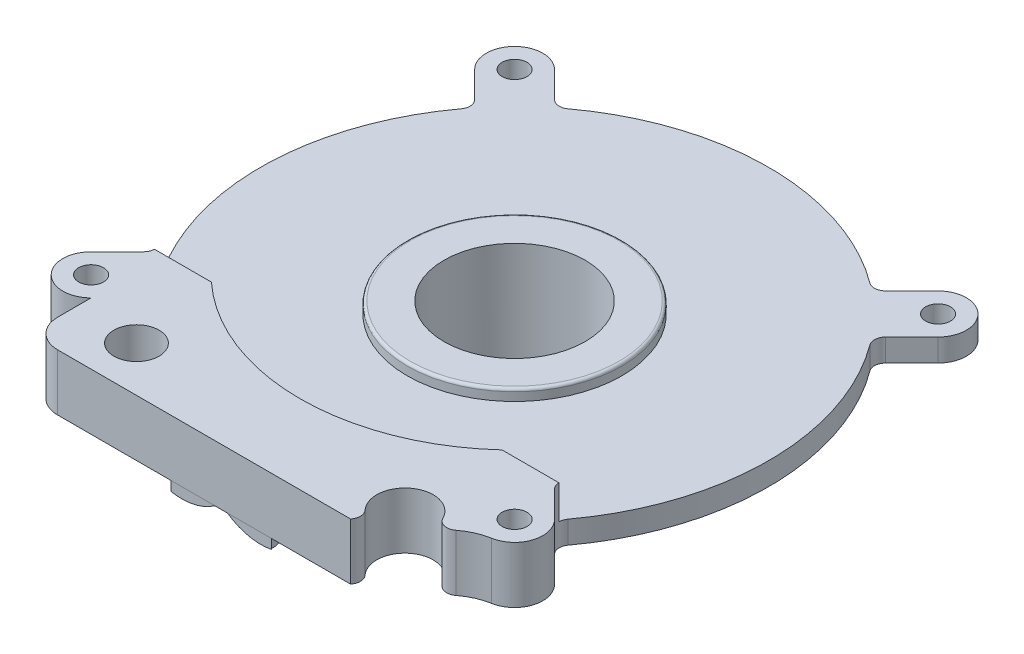
from build123d import *
from build123d.topology import SkipClean

# Parameters (mm, degrees)
SKETCH_1_R               = 15
SKETCH_1_R_2             = 12.5
EXTRUDE_1_DEPTH          = 20
SKETCH_2_R               = 17
SKETCH_2_R_2             = 12.5
EXTRUDE_2_DEPTH          = 6
SKETCH_3_R               = 12.5
SKETCH_3_R_2             = 7
SKETCH_3_R_3             = 1.65
EXTRUDE_3_DEPTH          = 3
EXTRUDE_START            = -2
SKETCH_5_R               = 19
SKETCH_5_R_2             = 17
EXTRUDE_5_DEPTH          = 2
SKETCH_6_W               = 26
SKETCH_6_H               = 26
SKETCH_6_R               = 12.5
EXTRUDE_6_DEPTH          = 2
EXTRUDE_START_2          = 4
SKETCH_7_R               = 45
SKETCH_7_R_2             = 17
EXTRUDE_7_DEPTH          = 4
EXTRUDE_START_3          = -4
SKETCH_8_R               = 2.2
EXTRUDE_8_DEPTH          = 4
SKETCH_9_R               = 4
EXTRUDE_9_DEPTH          = 4
FILLET_1_R               = 2
SKETCH_10_R              = 19
CUT_EXTRUDE_1_DEPTH      = 74.492092218
FILLET_2_R               = 0.5
FILLET_3_R               = 5
SKETCH_11_R              = 3
CUT_EXTRUDE_2_DEPTH      = 1.5
EXTRUDE_START_4          = 1
SKETCH_12_R              = 15.75
SKETCH_12_R_2            = 15
EXTRUDE_10_DEPTH         = 1
SKETCH_13_R              = 4
SKETCH_13_R_2            = 2.2
EXTRUDE_11_DEPTH         = 4.2
EXTRUDE_12_DEPTH         = 7
EXTRUDE_12_2_DEPTH       = 7
CHAMFER_1_SIZE           = 6.214619975
CHAMFER_1_SIZE_2         = 1.9
CHAMFER_2_SIZE           = 6.214619975
CHAMFER_2_SIZE_2         = 1.9
CUT_EXTRUDE_4_DEPTH      = 10
FILLET_4_R               = 2
SKETCH_16_R              = 2.2
SKETCH_16_R_2            = 4
EXTRUDE_13_DEPTH         = 3
CUT_EXTRUDE_START        = -0.2
CUT_EXTRUDE_5_DEPTH      = 0.2
CUT_EXTRUDE_6_DEPTH      = 112.30004797
CUT_EXTRUDE_6_DEPTH_BACK = 112.30004797
SKETCH_18_W              = 118.870739278
SKETCH_18_H              = 2


with BuildPart() as part:
    # 草图1 → 凸台-拉伸1 (new body)
    with BuildSketch(Plane(origin=(0, 0, 0), x_dir=(1, 0, 0), z_dir=(0, 1, 0))):
        with Locations(Location((0, 0, 0), (0, 0, 270))):
            Circle(SKETCH_1_R)
        with Locations(Location((0, 0, 0), (0, 0, 270))):
            Circle(SKETCH_1_R_2, mode=Mode.SUBTRACT)
    extrude(amount=EXTRUDE_1_DEPTH)

    # 草图2 → 凸台-拉伸2 (add)
    with BuildSketch(Plane(origin=(0, 20, 0), x_dir=(1, 0, 0), z_dir=(0, 1, 0))):
        with Locations(Location((0, 0, 0), (0, 0, 270))):
            Circle(SKETCH_2_R)
        with Locations(Location((0, 0, 0), (0, 0, 270))):
            Circle(SKETCH_2_R_2, mode=Mode.SUBTRACT)
    extrude(amount=EXTRUDE_2_DEPTH)

    # 草图3 → 凸台-拉伸3 (add)
    with BuildSketch(Plane.XZ):
        with Locations(Location((0, 0, 0), (0, 0, 270))):
            Circle(SKETCH_3_R)
        with Locations(Location((0, 0, 0), (0, 0, 270))):
            Circle(SKETCH_3_R_2, mode=Mode.SUBTRACT)
        with Locations(Location((9.5, 0, 0), (0, 0, 270))):
            Circle(SKETCH_3_R_3, mode=Mode.SUBTRACT)
        with Locations(Location((-4.75, -8.227241336, 0), (0, 0, 270))):
            Circle(SKETCH_3_R_3, mode=Mode.SUBTRACT)
        with Locations(Location((-4.75, 8.227241336, 0), (0, 0, 270))):
            Circle(SKETCH_3_R_3, mode=Mode.SUBTRACT)
    extrude(amount=-EXTRUDE_3_DEPTH)

    # 草图5 → 凸台-拉伸5 (add)
    with BuildSketch(Plane(origin=(0, 26, 0), x_dir=(1, 0, 0), z_dir=(0, 1, 0)).offset(EXTRUDE_START)):
        with Locations(Location((0, 0, 0), (0, 0, 270))):
            Circle(SKETCH_5_R)
        with Locations(Location((0, 0, 0), (0, 0, 270))):
            Circle(SKETCH_5_R_2, mode=Mode.SUBTRACT)
    extrude(amount=EXTRUDE_5_DEPTH)

    # 草图6 → 凸台-拉伸6 (add)
    with BuildSketch(Plane(origin=(0, 26, 0), x_dir=(1, 0, 0), z_dir=(0, 1, 0))):
        Rectangle(SKETCH_6_W, SKETCH_6_H)
        with Locations(Location((0, 0, 0), (0, 0, 90))):
            Circle(SKETCH_6_R, mode=Mode.SUBTRACT)
    extrude(amount=EXTRUDE_6_DEPTH)

    # 草图7 → 凸台-拉伸7 (add)
    with BuildSketch(Plane.XZ.offset(-24).offset(EXTRUDE_START_2)):
        with Locations(Location((0, 0, 0), (0, 0, 270))):
            Circle(SKETCH_7_R)
        Circle(SKETCH_7_R_2, mode=Mode.SUBTRACT)
    extrude(amount=-EXTRUDE_7_DEPTH)

    # 草图8 → 凸台-拉伸8 (add)
    # profile 1 of 4: a face of its own
    with BuildSketch(Plane(origin=(0, 24, 0), x_dir=(1, 0, 0), z_dir=(0, 1, 0)).offset(EXTRUDE_START_3)):
        with BuildLine():
            Line((-41.035533906, -33.964466094), (-35.158310508, -28.087242696))
            ThreePointArc((-35.158310508, -28.087242696), (-31.819805153, -31.819805153), (-28.087242696, -35.158310508))
            Line((-28.087242696, -35.158310508), (-33.964466094, -41.035533906))
            ThreePointArc((-33.964466094, -41.035533906), (-41.035533906, -41.035533906), (-41.035533906, -33.964466094))
        make_face()
        with Locations(Location((-37.5, -37.5, 0), (0, 0, 270))):
            Circle(SKETCH_8_R, mode=Mode.SUBTRACT)
    # profile 2 of 4: a face of its own
    with BuildSketch(Plane(origin=(0, 24, 0), x_dir=(1, 0, 0), z_dir=(0, 1, 0)).offset(EXTRUDE_START_3)):
        with BuildLine():
            Line((-41.035533906, 33.964466094), (-35.158310508, 28.087242696))
            ThreePointArc((-35.158310508, 28.087242696), (-31.819805153, 31.819805153), (-28.087242696, 35.158310508))
            Line((-28.087242696, 35.158310508), (-33.964466094, 41.035533906))
            ThreePointArc((-33.964466094, 41.035533906), (-41.035533906, 41.035533906), (-41.035533906, 33.964466094))
        make_face()
        with Locations(Location((-37.5, 37.5, 0), (0, 0, 270))):
            Circle(SKETCH_8_R, mode=Mode.SUBTRACT)
    # profile 3 of 4: a face of its own
    with BuildSketch(Plane(origin=(0, 24, 0), x_dir=(1, 0, 0), z_dir=(0, 1, 0)).offset(EXTRUDE_START_3)):
        with BuildLine():
            Line((28.087242696, 35.158310508), (33.964466094, 41.035533906))
            ThreePointArc((33.964466094, 41.035533906), (41.035533906, 41.035533906), (41.035533906, 33.964466094))
            Line((41.035533906, 33.964466094), (35.158310508, 28.087242696))
            ThreePointArc((35.158310508, 28.087242696), (31.819805153, 31.819805153), (28.087242696, 35.158310508))
        make_face()
        with Locations(Location((37.5, 37.5, 0), (0, 0, 270))):
            Circle(SKETCH_8_R, mode=Mode.SUBTRACT)
    # profile 4 of 4: a face of its own
    with BuildSketch(Plane(origin=(0, 24, 0), x_dir=(1, 0, 0), z_dir=(0, 1, 0)).offset(EXTRUDE_START_3)):
        with BuildLine():
            Line((35.158310508, -28.087242696), (41.035533906, -33.964466094))
            ThreePointArc((41.035533906, -33.964466094), (41.035533906, -41.035533906), (33.964466094, -41.035533906))
            Line((33.964466094, -41.035533906), (28.087242696, -35.158310508))
            ThreePointArc((28.087242696, -35.158310508), (31.819805153, -31.819805153), (35.158310508, -28.087242696))
        make_face()
        with Locations(Location((37.5, -37.5, 0), (0, 0, 270))):
            Circle(SKETCH_8_R, mode=Mode.SUBTRACT)
    extrude(amount=EXTRUDE_8_DEPTH)

    # 草图9 → 凸台-拉伸9 (add)
    with BuildSketch(Plane(origin=(0, 24, 0), x_dir=(1, 0, 0), z_dir=(0, 1, 0)).offset(EXTRUDE_START_3)):
        with BuildLine():
            Line((33.964466094, -41.035533906), (28.087242696, -35.158310508))
            ThreePointArc((28.087242696, -35.158310508), (0, -45), (-28.087242696, -35.158310508))
            Line((-28.087242696, -35.158310508), (-33.964466094, -41.035533906))
            Line((-33.964466094, -41.035533906), (-33.964466094, -51.96236733))
            Line((-33.964466094, -51.96236733), (22.906384924, -51.96236733))
            Line((22.906384924, -51.96236733), (27.649740331, -50.798447588))
            ThreePointArc((27.649740331, -50.798447588), (23.364635585, -42.046040599), (31.045885235, -48.043136112))
            ThreePointArc((31.045885235, -48.043136112), (34.020425636, -44.337927578), (38.36930714, -42.423850637))
            ThreePointArc((38.36930714, -42.423850637), (35.996987316, -42.268747516), (33.964466094, -41.035533906))
        make_face()
        with Locations(Location((-23.001616716, -43.96067534, 0), (0, 0, 270))):
            Circle(SKETCH_9_R, mode=Mode.SUBTRACT)
    extrude(amount=EXTRUDE_9_DEPTH)

    # 圆角1
    # the kernel refuses this fillet: 2 mm, written as the material it takes off along each edge
    with BuildSketch(Plane(origin=(31.045885235, 8.214854918, 48.043136112), x_dir=(-0.015052067443698006, 0, -0.9998867112156609), z_dir=(0, 1, 0))) as fillet_1_piece_1:
        with BuildLine():
            CenterArc((5.237242596, -1.799472632), FILLET_1_R, 115.876571243, 100.980737452)
            Line((3.636978972, -2.999121053), (3.6049737, -3.023114021))
            ThreePointArc((3.6049737, -3.023114021), (1.972291731, -1.313047371), (-0.017457357, -0.035989453))
            Line((-0.017457357, -0.035989453), (0.017457357, 0.035989453))
            ThreePointArc((0.017457357, 0.035989453), (2.182187383, -0.461322512), (4.34691741, 0.035989453))
            Line((4.34691741, 0.035989453), (4.364374767, 0))
        make_face()
    extrude(amount=27.570290164, mode=Mode.SUBTRACT)
    with BuildSketch(Plane(origin=(27.649740331, 7.426134815, 50.798447588), x_dir=(-0.9711892764491741, 0, 0.23830944024551268), z_dir=(0, 1, 0))) as fillet_1_piece_2:
        with BuildLine():
            CenterArc((6.067575487, -1.612238295), FILLET_1_R, 126.281523765, 82.66024712)
            Line((4.317351562, -2.580079301), (4.282347084, -2.599436121))
            ThreePointArc((4.282347084, -2.599436121), (2.486180213, -0.742013172), (-0.000465948, -0.039997286))
            Line((-0.000465948, -0.039997286), (0, 0.04))
            ThreePointArc((0, 0.04), (2.442034484, 0.04), (4.860398838, 0.032244766))
            Line((4.860398838, 0.032244766), (4.884068968, 0))
        make_face()
    extrude(amount=29.147730371, mode=Mode.SUBTRACT)

    # 草图10 → 切除-拉伸1 (cut, through all)
    with BuildSketch(Plane(origin=(0, 26, 0), x_dir=(1, 0, 0), z_dir=(0, 1, 0))):
        with Locations(Location((0, 0, 0), (0, 0, 270))):
            Circle(SKETCH_10_R)
    extrude(amount=CUT_EXTRUDE_1_DEPTH, mode=Mode.SUBTRACT)

    # 圆角2
    fillet_2_edges = [part.edges().sort_by_distance(p)[0] for p in [
        (0, 26, -19),
    ]]
    fillet(fillet_2_edges, radius=FILLET_2_R)

    # 圆角3
    fillet_3_edges = [part.edges().sort_by_distance(p)[0] for p in [
        (-33.964466094, 22, 51.96236733),
    ]]
    fillet(fillet_3_edges, radius=FILLET_3_R)

    # 草图11 → 切除-拉伸2 (cut)
    with BuildSketch(Plane.XZ):
        with Locations((-4.75, 8.227241336)):
            Circle(SKETCH_11_R)
        with Locations((9.5, 0)):
            Circle(SKETCH_11_R)
        with Locations((-4.75, -8.227241336)):
            Circle(SKETCH_11_R)
    extrude(amount=-CUT_EXTRUDE_2_DEPTH, mode=Mode.SUBTRACT)

    # 草图12 → 凸台-拉伸10 (add)
    with BuildSketch(Plane.XZ.offset(-20).offset(EXTRUDE_START_4)):
        with Locations(Location((0, 0, 0), (0, 0, 90))):
            Circle(SKETCH_12_R)
        with Locations(Location((0, 0, 0), (0, 0, 270))):
            Circle(SKETCH_12_R_2, mode=Mode.SUBTRACT)
    extrude(amount=-EXTRUDE_10_DEPTH)

    # 草图13 → 凸台-拉伸11 (add)
    # profile 1 of 2: a face of its own
    with BuildSketch(Plane(origin=(0, 24, 0), x_dir=(1, 0, 0), z_dir=(0, 1, 0))):
        with BuildLine():
            Line((-25.73142074, -27.96236733), (-35.257708566, -27.96236733))
            ThreePointArc((-35.257708566, -27.96236733), (-35.2080649, -28.024849081), (-35.158310508, -28.087242696))
            ThreePointArc((-35.158310508, -28.087242696), (0, -45), (35.158310508, -28.087242696))
            ThreePointArc((35.158310508, -28.087242696), (35.2080649, -28.024849081), (35.257708566, -27.96236733))
            Line((35.257708566, -27.96236733), (25.73142074, -27.96236733))
            ThreePointArc((25.73142074, -27.96236733), (0, -38), (-25.73142074, -27.96236733))
        make_face()
    # profile 2 of 2: a face of its own
    with BuildSketch(Plane(origin=(0, 24, 0), x_dir=(1, 0, 0), z_dir=(0, 1, 0))):
        with BuildLine():
            ThreePointArc((35.158310508, -28.087242696), (0, -45), (-35.158310508, -28.087242696))
            Line((-35.158310508, -28.087242696), (-41.035533906, -33.964466094))
            ThreePointArc((-41.035533906, -33.964466094), (-41.035533906, -41.035533906), (-33.964466094, -41.035533906))
            Line((-33.964466094, -41.035533906), (-33.964466094, -46.96236733))
            ThreePointArc((-33.964466094, -46.96236733), (-32.5, -50.497901236), (-28.964466094, -51.96236733))
            Line((-28.964466094, -51.96236733), (22.906384924, -51.96236733))
            ThreePointArc((22.906384924, -51.96236733), (23.372168796, -50.629809961), (22.841917537, -49.321567873))
            ThreePointArc((22.841917537, -49.321567873), (23.665985567, -41.819836541), (30.980192372, -43.67925578))
            ThreePointArc((30.980192372, -43.67925578), (32.324226236, -44.729926812), (33.989922469, -44.361426197))
            ThreePointArc((33.989922469, -44.361426197), (36.06191813, -43.126615751), (38.36930714, -42.423850637))
            ThreePointArc((38.36930714, -42.423850637), (42.268747516, -39.003012684), (41.035533906, -33.964466094))
            Line((41.035533906, -33.964466094), (35.158310508, -28.087242696))
        make_face()
        with Locations(Location((-23.001616716, -43.96067534, 0), (0, 0, 270))):
            Circle(SKETCH_13_R, mode=Mode.SUBTRACT)
        with Locations(Location((-37.5, -37.5, 0), (0, 0, 270))):
            Circle(SKETCH_13_R_2, mode=Mode.SUBTRACT)
        with Locations(Location((37.5, -37.5, 0), (0, 0, 270))):
            Circle(SKETCH_13_R_2, mode=Mode.SUBTRACT)
    extrude(amount=EXTRUDE_11_DEPTH)

    # 圆角4
    # the kernel refuses this fillet: 2 mm, written as the material it adds along each edge
    with BuildSketch(Plane(origin=(-35.158310508, 24, 28.087242696), x_dir=(-0.6091445543009105, 0, -0.793059210882482), z_dir=(0, 1, 0))) as fillet_4_piece_1_section:
        with BuildLine():
            CenterArc((1.754855317, 1.99963613), FILLET_4_R, 187.472325658, 81.434718893)
            Line((-0.228160265, 1.739541528), (0, 0))
            ThreePointArc((0, 0), (0.858353144, 0.008187079), (1.716706288, 0))
        make_face()
    fillet_4_piece_1 = extrude(amount=4.2, mode=Mode.PRIVATE)
    fillet_4_piece_1 = split(fillet_4_piece_1, bisect_by=Plane(origin=(-35.158310508, 24, 27.96236733), z_dir=(0, 0, 1)), keep=Keep.TOP, mode=Mode.PRIVATE)
    add(fillet_4_piece_1)
    with BuildSketch(Plane(origin=(28.087242696, 20, -35.158310508), x_dir=(0.7071067811865485, 0, -0.7071067811865465), z_dir=(0, 1, 0)), Plane(origin=(-35.158310508, 20, -28.087242696), x_dir=(-0.7071067811865496, 0, -0.7071067811865455), z_dir=(0, 1, 0))) as fillet_4_piece_2:
        with BuildLine():
            CenterArc((1.754440604, 2), FILLET_4_R, 188.565281108, 81.434718892)
            ThreePointArc((-0.223253019, 1.70212766), (-0.103508957, 0.852128537), (0, 0))
            Line((0, 0), (1.754440604, 0))
        make_face()
    extrude(amount=4)
    with BuildSketch(Plane(origin=(35.158310508, 20, -28.087242696), x_dir=(0.6091445542993271, 0, 0.7930592108836982), z_dir=(0, 1, 0)), Plane(origin=(-28.087242696, 20, -35.158310508), x_dir=(0.7930592108837022, 0, -0.6091445542993219), z_dir=(0, 1, 0)), Plane(origin=(-35.158310508, 20, 28.087242696), x_dir=(-0.6091445542993226, 0, -0.7930592108837018), z_dir=(0, 1, 0))) as fillet_4_piece_3:
        with BuildLine():
            CenterArc((1.754855317, 1.99963613), FILLET_4_R, 187.472325658, 81.434718892)
            Line((-0.228160265, 1.739541528), (0, 0))
            ThreePointArc((0, 0), (0.858353144, 0.008187079), (1.716706288, 0))
        make_face()
    extrude(amount=4)
    with BuildSketch(Plane(origin=(35.158310508, 24, 28.087242696), x_dir=(0.6091445574940213, 0, -0.7930592084298707), z_dir=(0, 1, 0))) as fillet_4_piece_4_section:
        with BuildLine():
            CenterArc((1.754855324, -1.99963613), FILLET_4_R, 91.092955673, 81.4347189)
            Line((-0.228160259, -1.739541536), (0, 0))
            ThreePointArc((0, 0), (0.858353144, -0.008187083), (1.716706288, 0))
        make_face()
    fillet_4_piece_4 = extrude(amount=4.2, mode=Mode.PRIVATE)
    fillet_4_piece_4 = split(fillet_4_piece_4, bisect_by=Plane(origin=(35.158310508, 24, 27.96236733), z_dir=(0, 0, 1)), keep=Keep.TOP, mode=Mode.PRIVATE)
    add(fillet_4_piece_4)
    with BuildSketch(Plane(origin=(35.158310508, 20, 28.087242696), x_dir=(0.609144554299323, 0, -0.7930592108837013), z_dir=(0, 1, 0))) as fillet_4_piece_5:
        with BuildLine():
            CenterArc((1.754855317, -1.99963613), FILLET_4_R, 91.09295545, 81.434718892)
            Line((-0.228160265, -1.739541528), (0, 0))
            ThreePointArc((0, 0), (0.858353144, -0.008187079), (1.716706288, 0))
        make_face()
    extrude(amount=4)

    # 草图16 → 凸台-拉伸13 (add)
    with BuildSketch(Plane(origin=(0, 28.2, 0), x_dir=(1, 0, 0), z_dir=(0, 1, 0))):
        with BuildLine():
            Line((-25.73142074, -27.96236733), (-35.813695424, -27.96236733))
            ThreePointArc((-35.813695424, -27.96236733), (-35.974809945, -28.701442447), (-36.398887356, -29.327819544))
            Line((-36.398887356, -29.327819544), (-41.035533906, -33.964466094))
            ThreePointArc((-41.035533906, -33.964466094), (-41.035533906, -41.035533906), (-33.964466094, -41.035533906))
            Line((-33.964466094, -41.035533906), (-33.964466094, -46.96236733))
            ThreePointArc((-33.964466094, -46.96236733), (-32.5, -50.497901236), (-28.964466094, -51.96236733))
            Line((-28.964466094, -51.96236733), (22.906384924, -51.96236733))
            ThreePointArc((22.906384924, -51.96236733), (23.372168796, -50.629809961), (22.841917537, -49.321567873))
            ThreePointArc((22.841917537, -49.321567873), (23.665985567, -41.819836541), (30.980192372, -43.67925578))
            ThreePointArc((30.980192372, -43.67925578), (32.324226236, -44.729926812), (33.989922469, -44.361426197))
            ThreePointArc((33.989922469, -44.361426197), (36.06191813, -43.126615751), (38.36930714, -42.423850637))
            ThreePointArc((38.36930714, -42.423850637), (42.268747516, -39.003012684), (41.035533906, -33.964466094))
            Line((41.035533906, -33.964466094), (36.398887356, -29.327819544))
            ThreePointArc((36.398887356, -29.327819544), (35.974809945, -28.701442447), (35.813695424, -27.96236733))
            Line((35.813695424, -27.96236733), (25.73142074, -27.96236733))
            ThreePointArc((25.73142074, -27.96236733), (0, -38), (-25.73142074, -27.96236733))
        make_face()
        with Locations(Location((-37.5, -37.5, 0), (0, 0, 270))):
            Circle(SKETCH_16_R, mode=Mode.SUBTRACT)
        with Locations(Location((-23.001616716, -43.96067534, 0), (0, 0, 270))):
            Circle(SKETCH_16_R_2, mode=Mode.SUBTRACT)
        with Locations(Location((37.5, -37.5, 0), (0, 0, 270))):
            Circle(SKETCH_16_R, mode=Mode.SUBTRACT)
    extrude(amount=EXTRUDE_13_DEPTH)

    # 草图17 → 切除-拉伸5 (cut)
    with SkipClean():  # the faces are left unmerged after this step: merging them gives an invalid solid
        with BuildSketch(Plane(origin=(0, 31.2, 0), x_dir=(1, 0, 0), z_dir=(0, 1, 0)).offset(CUT_EXTRUDE_START)):
            with BuildLine():
                Line((-25.73142074, -27.96236733), (-35.813695424, -27.96236733))
                ThreePointArc((-35.813695424, -27.96236733), (-35.974809945, -28.701442447), (-36.398887356, -29.327819544))
                Line((-36.398887356, -29.327819544), (-41.035533906, -33.964466094))
                ThreePointArc((-41.035533906, -33.964466094), (-41.035533906, -41.035533906), (-33.964466094, -41.035533906))
                Line((-33.964466094, -41.035533906), (-33.964466094, -46.96236733))
                ThreePointArc((-33.964466094, -46.96236733), (-32.5, -50.497901236), (-28.964466094, -51.96236733))
                Line((-28.964466094, -51.96236733), (22.906384924, -51.96236733))
                ThreePointArc((22.906384924, -51.96236733), (23.372168796, -50.629809961), (22.841917537, -49.321567873))
                ThreePointArc((22.841917537, -49.321567873), (23.665985567, -41.819836541), (30.980192372, -43.67925578))
                ThreePointArc((30.980192372, -43.67925578), (32.324226236, -44.729926812), (33.989922469, -44.361426197))
                ThreePointArc((33.989922469, -44.361426197), (36.06191813, -43.126615751), (38.36930714, -42.423850637))
                ThreePointArc((38.36930714, -42.423850637), (42.268747516, -39.003012684), (41.035533906, -33.964466094))
                Line((41.035533906, -33.964466094), (36.398887356, -29.327819544))
                ThreePointArc((36.398887356, -29.327819544), (35.974809945, -28.701442447), (35.813695424, -27.96236733))
                Line((35.813695424, -27.96236733), (25.73142074, -27.96236733))
                ThreePointArc((25.73142074, -27.96236733), (0, -38), (-25.73142074, -27.96236733))
            make_face()
        extrude(amount=CUT_EXTRUDE_5_DEPTH, mode=Mode.SUBTRACT)

    # 草图18 → 切除-拉伸6 (cut, two sides: drawn at the far end of the back side and taken through both)
    with SkipClean():  # the faces are left unmerged after this step: merging them gives an invalid solid
        with BuildSketch(Plane.XY.offset(51.96236733).offset(-CUT_EXTRUDE_6_DEPTH_BACK)):
            with Locations((0, 31)):
                Rectangle(SKETCH_18_W, SKETCH_18_H)
        extrude(amount=CUT_EXTRUDE_6_DEPTH + CUT_EXTRUDE_6_DEPTH_BACK, mode=Mode.SUBTRACT)


with BuildPart() as body_2:
    # 草图14 → 凸台-拉伸12 (new body)
    with BuildSketch(Plane.XY.offset(51.96236733)):
        with BuildLine():
            Line((-8.9, 20), (-8.9, 18.309193402))
            ThreePointArc((-8.9, 18.309193402), (-4.839364384, 18.362300557), (-1.123247794, 20))
            Line((-1.123247794, 20), (-8.9, 20))
        make_face()
    extrude(amount=-EXTRUDE_12_DEPTH)

    # 倒角2
    # the kernel refuses this chamfer: 6.214619975, 1.9 mm, written as the material it takes off along each edge
    with BuildSketch(Plane(origin=(-7, 28.3, 44.96236733), x_dir=(-0.9793563195214127, 0.20214153312338567, 0), z_dir=(0.20214153312338567, 0.9793563195214127, 0))) as chamfer_2_piece_1:
        Polygon((10.169868066, CHAMFER_2_SIZE), (10.169868066 - CHAMFER_2_SIZE_2, 0), (10.169868066, 0), align=None)
    revolve(axis=Axis((-7, 28.3, 44.96236733), (0, 0, 1)), revolution_arc=227.856914302, mode=Mode.SUBTRACT)


with BuildPart() as body_3:
    # 草图14 → Extrude 12 2 (new body)
    with BuildSketch(Plane.XY.offset(51.96236733)):
        with BuildLine():
            Line((8.9, 18.309193402), (8.9, 20))
            Line((8.9, 20), (1.123247794, 20))
            ThreePointArc((1.123247794, 20), (4.839364384, 18.362300557), (8.9, 18.309193402))
        make_face()
    extrude(amount=-EXTRUDE_12_2_DEPTH)

    # 倒角1
    # the kernel refuses this chamfer: 6.214619975, 1.9 mm, written as the material it takes off along each edge
    with BuildSketch(Plane(origin=(7, 28.3, 44.96236733), x_dir=(-0.8070149800028303, 0.5905309662084042, 0), z_dir=(0.5905309662084042, 0.8070149800028303, 0))) as chamfer_1_piece_1:
        Polygon((10.169868066, CHAMFER_1_SIZE), (10.169868066 - CHAMFER_1_SIZE_2, 0), (10.169868066, 0), align=None)
    revolve(axis=Axis((7, 28.3, 44.96236733), (0, 0, 1)), revolution_arc=227.856914302, mode=Mode.SUBTRACT)

    # 草图15 → 切除-拉伸4 (cut)
    with BuildSketch(Plane.XZ.offset(-20)):
        with BuildLine():
            Line((12.726349477, 51.96236733), (8.749992214, 51.961517474))
            ThreePointArc((8.749992214, 51.961517474), (8.140258783, 45.114432982), (6.330246869, 38.482827009))
            Line((6.330246869, 38.482827009), (12.726349477, 51.96236733))
        make_face()
    extrude(amount=CUT_EXTRUDE_4_DEPTH, mode=Mode.SUBTRACT)


solid = Compound([part.part, body_2.part, body_3.part])
